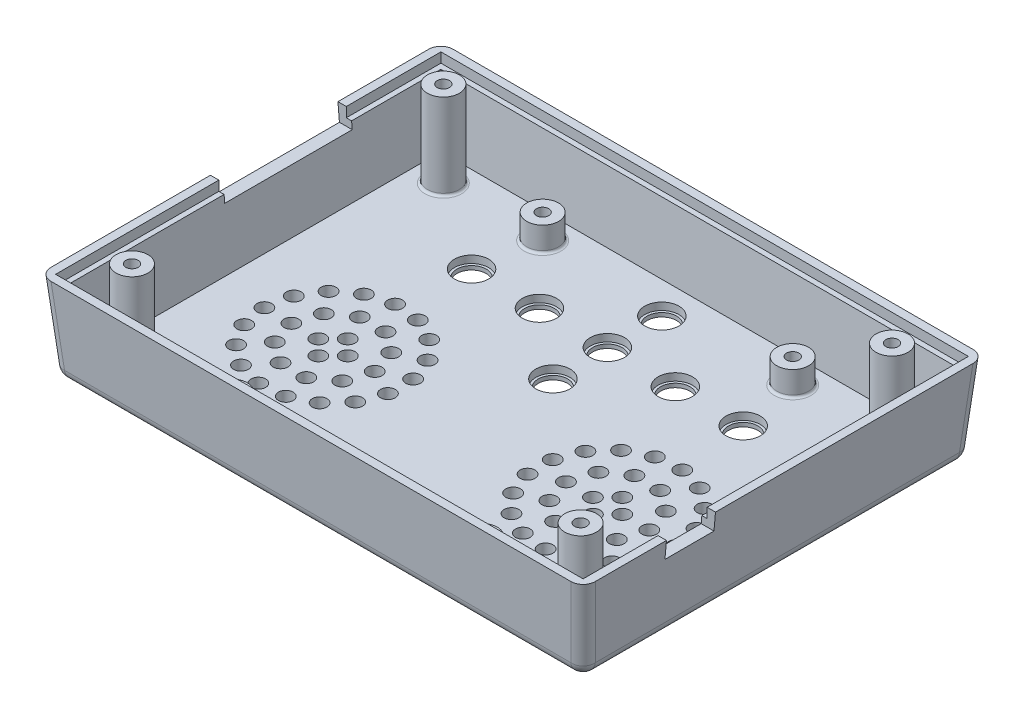
from build123d import *

# Parameters (mm, degrees)
SKETCH_1_W             = 111
SKETCH_1_H             = 82
EXTRUDE_466_DEPTH      = 18
EXTRUDE_466_DRAFT      = -5
SHELL_544_T            = -2.6
FILLET_584_R           = 2.5
SKETCH_7_W             = 102
SKETCH_7_H             = 73
CUT_EXTRUDE_1196_DEPTH = 0.3
CUT_EXTRUDE_1542_DEPTH = 2
SKETCH_4_R             = 3.25
SKETCH_4_R_2           = 1.25
EXTRUDE_3_DEPTH        = 17.5
FILLET_2_R             = 0.5
FILLET_2_OF_MIRROR_1_R = 0.5
SKETCH_8_R             = 3.25
SKETCH_8_R_2           = 1.25
EXTRUDE_4_DEPTH        = 5
FILLET_3_R             = 0.5
FILLET_3_OF_MIRROR_7_R = 0.5
SKETCH_9_W             = 26
SKETCH_9_H             = 3.5
CUT_EXTRUDE_2560_DEPTH = 5
SKETCH_10_W            = 10
SKETCH_10_H            = 3.5
CUT_EXTRUDE_2738_DEPTH = 5
SKETCH_12_R            = 3
CUT_EXTRUDE_3424_DEPTH = 4
SKETCH_14_R            = 3.5
CUT_EXTRUDE_4064_DEPTH = 1.5
SKETCH_13_R            = 1.5
CUT_EXTRUDE_4136_DEPTH = 3
SKETCH_15_R            = 1.5
CUT_EXTRUDE_12_DEPTH   = 3


# Read off the part's stored shape, not the designer's step: Зеркальное отражение2, Зеркальное отражение8
with BuildPart() as part:
    # Эскиз1 → Extrude 466 (with draft: the straight prism first)
    with BuildSketch(Plane(origin=(0, 0, 0), x_dir=(1, 0, 0), z_dir=(0, 1, 0))):
        Rectangle(SKETCH_1_W, SKETCH_1_H)
    extrude(amount=-EXTRUDE_466_DEPTH)
    # Extrude 466: the draft: its side faces are tilted about the plane it starts from
    extrude_466_sides = [part.faces().sort_by_distance(p)[0] for p in [
        (-55.5, -9, 0),
        (0, -9, 41),
        (55.5, -9, 0),
        (0, -9, -41),
    ]]
    draft(extrude_466_sides, Plane(origin=(0, 0, 0), x_dir=(1, 0, 0), z_dir=(0, 1, 0)), EXTRUDE_466_DRAFT)

    # Shell 544
    shell_544_openings = [part.faces().sort_by_distance(p)[0] for p in [
        (0, 0, 0),
    ]]
    offset(amount=SHELL_544_T, openings=shell_544_openings, kind=Kind.INTERSECTION)

    # Fillet 584
    fillet_584_edges = [part.edges().sort_by_distance(p)[0] for p in [
        (53.925204057, -18, 0),
        (0, -18, -39.425204057),
        (-53.925204057, -18, 0),
        (0, -18, 39.425204057),
        (-54.712602028, -9, -40.212602028),
        (54.712602028, -9, -40.212602028),
        (54.712602028, -9, 40.212602028),
        (-54.712602028, -9, 40.212602028),
    ]]
    fillet(fillet_584_edges, radius=FILLET_584_R)

    # Эскиз7 → Cut-Extrude 1196 (cut)
    with BuildSketch(Plane.XZ.offset(18)):
        Rectangle(SKETCH_7_W, SKETCH_7_H)
    extrude(amount=-CUT_EXTRUDE_1196_DEPTH, mode=Mode.SUBTRACT)

    # Эскиз3 → Cut-Extrude 1542 (cut)
    with BuildSketch(Plane(origin=(0, 0, 0), x_dir=(-1, 0, 0), z_dir=(0, 1, 0))):
        Polygon((-53.79, 39.29), (-53.79, -39.290136845), (53.79, -39.29), (53.79, 39.29), align=None)
    extrude(amount=-CUT_EXTRUDE_1542_DEPTH, mode=Mode.SUBTRACT)

    # Эскиз4 → Бобышка-Вытянуть3 (add)
    with BuildSketch(Plane(origin=(0, -15.4, 0), x_dir=(1, 0, 0), z_dir=(0, 1, 0))):
        with Locations(Location((-45.75, 31.75, 0), (0, 0, 270))):
            Circle(SKETCH_4_R)
        with Locations(Location((-45.75, 31.75, 0), (0, 0, 270))):
            Circle(SKETCH_4_R_2, mode=Mode.SUBTRACT)
    extrude_3 = extrude(amount=EXTRUDE_3_DEPTH)

    # Скругление2
    fillet_2_edges = [part.edges().sort_by_distance(p)[0] for p in [
        (-45.75, -15.4, -35),
    ]]
    fillet(fillet_2_edges, radius=FILLET_2_R)

    # Зеркальное отражение1: Бобышка-Вытянуть3 across plane
    add(extrude_3.mirror(Plane(origin=(0, 0, 0), x_dir=(0, 0, 1), z_dir=(1, 0, 0))))

    # Скругление2 of Зеркальное отражение1
    fillet_2_of_mirror_1_edges = [part.edges().sort_by_distance(p)[0] for p in [
        (45.75, -15.4, -35),
    ]]
    fillet(fillet_2_of_mirror_1_edges, radius=FILLET_2_OF_MIRROR_1_R)

    # Зеркальное отражение2 outline → Зеркальное отражение2 (revolve)
    with BuildSketch(Plane(origin=(45.75, 0, 31.75), x_dir=(1, 0, 0), z_dir=(0, 0, 1))):
        with BuildLine():
            Line((3.25, 2.1), (1.25, 2.1))
            Line((1.25, 2.1), (1.25, -15.4))
            Line((1.25, -15.4), (3.75, -15.4))
            ThreePointArc((3.75, -15.4), (3.396446609, -15.253553391), (3.25, -14.9))
            Line((3.25, -14.9), (3.25, 2.1))
        make_face()
    revolve(axis=Axis((45.75, 0, 31.75), (0, 1, 0)))

    # Mirror 2 2 outline → Mirror 2 2 (revolve)
    with BuildSketch(Plane(origin=(-45.75, 0, 31.75), x_dir=(1, 0, 0), z_dir=(0, 0, 1))):
        with BuildLine():
            Line((3.25, 2.1), (1.25, 2.1))
            Line((1.25, 2.1), (1.25, -15.4))
            Line((1.25, -15.4), (3.75, -15.4))
            ThreePointArc((3.75, -15.4), (3.396446609, -15.253553391), (3.25, -14.9))
            Line((3.25, -14.9), (3.25, 2.1))
        make_face()
    revolve(axis=Axis((-45.75, 0, 31.75), (0, 1, 0)))

    # Эскиз8 → Бобышка-Вытянуть4 (add)
    with BuildSketch(Plane(origin=(0, -15.4, 0), x_dir=(1, 0, 0), z_dir=(0, 1, 0))):
        with Locations(Location((-25.5, 31.75, 0), (0, 0, 270))):
            Circle(SKETCH_8_R)
        with Locations(Location((-25.5, 31.75, 0), (0, 0, 270))):
            Circle(SKETCH_8_R_2, mode=Mode.SUBTRACT)
    extrude_4 = extrude(amount=EXTRUDE_4_DEPTH)

    # Скругление3
    fillet_3_edges = [part.edges().sort_by_distance(p)[0] for p in [
        (-25.5, -15.4, -35),
    ]]
    fillet(fillet_3_edges, radius=FILLET_3_R)

    # Зеркальное отражение7: Бобышка-Вытянуть4 across plane
    add(extrude_4.mirror(Plane(origin=(0, 0, 0), x_dir=(0, 0, 1), z_dir=(1, 0, 0))))

    # Скругление3 of Зеркальное отражение7
    fillet_3_of_mirror_7_edges = [part.edges().sort_by_distance(p)[0] for p in [
        (25.5, -15.4, -35),
    ]]
    fillet(fillet_3_of_mirror_7_edges, radius=FILLET_3_OF_MIRROR_7_R)

    # Зеркальное отражение8 outline → Зеркальное отражение8 (revolve)
    with BuildSketch(Plane(origin=(25.5, 0, 31.75), x_dir=(1, 0, 0), z_dir=(0, 0, 1))):
        with BuildLine():
            Line((3.25, -10.4), (1.25, -10.4))
            Line((1.25, -10.4), (1.25, -15.4))
            Line((1.25, -15.4), (3.75, -15.4))
            ThreePointArc((3.75, -15.4), (3.396446609, -15.253553391), (3.25, -14.9))
            Line((3.25, -14.9), (3.25, -10.4))
        make_face()
    revolve(axis=Axis((25.5, 0, 31.75), (0, 1, 0)))

    # Mirror 8 2 outline → Mirror 8 2 (revolve)
    with BuildSketch(Plane(origin=(-25.5, 0, 31.75), x_dir=(1, 0, 0), z_dir=(0, 0, 1))):
        with BuildLine():
            Line((3.25, -10.4), (1.25, -10.4))
            Line((1.25, -10.4), (1.25, -15.4))
            Line((1.25, -15.4), (3.75, -15.4))
            ThreePointArc((3.75, -15.4), (3.396446609, -15.253553391), (3.25, -14.9))
            Line((3.25, -14.9), (3.25, -10.4))
        make_face()
    revolve(axis=Axis((-25.5, 0, 31.75), (0, 1, 0)))

    # Эскиз9 → Cut-Extrude 2560 (cut)
    with BuildSketch(Plane(origin=(-55.5, 0, 0), x_dir=(0, 0, -1), z_dir=(1, 0, 0))):
        with Locations((7, -1.75)):
            Rectangle(SKETCH_9_W, SKETCH_9_H)
    extrude(amount=CUT_EXTRUDE_2560_DEPTH, mode=Mode.SUBTRACT)

    # Эскиз10 → Cut-Extrude 2738 (cut)
    with BuildSketch(Plane(origin=(55.5, 0, 0), x_dir=(0, 0, -1), z_dir=(1, 0, 0))):
        with Locations((-19, -1.75)):
            Rectangle(SKETCH_10_W, SKETCH_10_H)
    extrude(amount=-CUT_EXTRUDE_2738_DEPTH, mode=Mode.SUBTRACT)

    # Эскиз12 → Cut-Extrude 3424 (cut)
    with BuildSketch(Plane(origin=(0, -17.7, -17.7), x_dir=(1, 0, 0), z_dir=(0, 1, 0))):
        with Locations(Location((0, 12.86, 0), (0, 0, 270))):
            Circle(SKETCH_12_R)
        with Locations(Location((-13.85, 1.75, 0), (0, 0, 270))):
            Circle(SKETCH_12_R)
        with Locations(Location((13.85, 1.75, 0), (0, 0, 270))):
            Circle(SKETCH_12_R)
        with Locations(Location((-27.7, 1.75, 0), (0, 0, 270))):
            Circle(SKETCH_12_R)
        with Locations(Location((27.7, 1.75, 0), (0, 0, 270))):
            Circle(SKETCH_12_R)
        with Locations(Location((0, -47.55, 0), (0, 0, 270))):
            Circle(SKETCH_12_R)
        with Locations(Location((0, 1.75, 0), (0, 0, 270))):
            Circle(SKETCH_12_R)
        with Locations(Location((0, -9.35, 0), (0, 0, 270))):
            Circle(SKETCH_12_R)
    extrude(amount=CUT_EXTRUDE_3424_DEPTH, mode=Mode.SUBTRACT)

    # Эскиз14 → Cut-Extrude 4064 (cut)
    with BuildSketch(Plane(origin=(0, -15.4, 0), x_dir=(1, 0, 0), z_dir=(0, 1, 0))):
        with Locations(Location((0, 30.56, 0), (0, 0, 270))):
            Circle(SKETCH_14_R)
        with Locations(Location((-13.85, 19.45, 0), (0, 0, 270))):
            Circle(SKETCH_14_R)
        with Locations(Location((13.85, 19.45, 0), (0, 0, 270))):
            Circle(SKETCH_14_R)
        with Locations(Location((-27.7, 19.45, 0), (0, 0, 270))):
            Circle(SKETCH_14_R)
        with Locations(Location((27.7, 19.45, 0), (0, 0, 270))):
            Circle(SKETCH_14_R)
        with Locations(Location((0, -29.85, 0), (0, 0, 270))):
            Circle(SKETCH_14_R)
        with Locations(Location((0, 19.45, 0), (0, 0, 270))):
            Circle(SKETCH_14_R)
        with Locations(Location((0, 8.35, 0), (0, 0, 270))):
            Circle(SKETCH_14_R)
    extrude(amount=-CUT_EXTRUDE_4064_DEPTH, mode=Mode.SUBTRACT)

    # Эскиз13 → Cut-Extrude 4136 (cut)
    with BuildSketch(Plane.XZ.offset(17.7)):
        with Locations(Location((42, 8.5, 0), (0, 0, 270))):
            Circle(SKETCH_13_R)
        with Locations(Location((36.5, 8.5, 0), (0, 0, 270))):
            Circle(SKETCH_13_R)
        with Locations(Location((31, 8.5, 0), (0, 0, 270))):
            Circle(SKETCH_13_R)
        with Locations(Location((34.876644452, 3.503825356, 0), (0, 0, 270))):
            Circle(SKETCH_13_R)
        with Locations(Location((30.626644452, 0.416019611, 0), (0, 0, 270))):
            Circle(SKETCH_13_R)
        with Locations(Location((25.373355548, 0.416019611, 0), (0, 0, 270))):
            Circle(SKETCH_13_R)
        with Locations(Location((21.123355548, 3.503825356, 0), (0, 0, 270))):
            Circle(SKETCH_13_R)
        with Locations(Location((19.5, 8.5, 0), (0, 0, 270))):
            Circle(SKETCH_13_R)
        with Locations(Location((21.123355548, 13.496174644, 0), (0, 0, 270))):
            Circle(SKETCH_13_R)
        with Locations(Location((25.373355548, 16.583980389, 0), (0, 0, 270))):
            Circle(SKETCH_13_R)
        with Locations(Location((30.626644452, 16.583980389, 0), (0, 0, 270))):
            Circle(SKETCH_13_R)
        with Locations(Location((34.876644452, 13.496174644, 0), (0, 0, 270))):
            Circle(SKETCH_13_R)
        with Locations(Location((28, 5.5, 0), (0, 0, 270))):
            Circle(SKETCH_13_R)
        with Locations(Location((25, 8.5, 0), (0, 0, 270))):
            Circle(SKETCH_13_R)
        with Locations(Location((28, 11.5, 0), (0, 0, 270))):
            Circle(SKETCH_13_R)
        with Locations(Location((41.054611212, 3.442616673, 0), (0, 0, 270))):
            Circle(SKETCH_13_R)
        with Locations(Location((38.346124841, -0.931739011, 0), (0, 0, 270))):
            Circle(SKETCH_13_R)
        with Locations(Location((34.240336981, -4.032286079, 0), (0, 0, 270))):
            Circle(SKETCH_13_R)
        with Locations(Location((29.291757032, -5.440278468, 0), (0, 0, 270))):
            Circle(SKETCH_13_R)
        with Locations(Location((24.168718139, -4.965559004, 0), (0, 0, 270))):
            Circle(SKETCH_13_R)
        with Locations(Location((19.563115091, -2.672241182, 0), (0, 0, 270))):
            Circle(SKETCH_13_R)
        with Locations(Location((16.0969601, 1.12994972, 0), (0, 0, 270))):
            Circle(SKETCH_13_R)
        with Locations(Location((14.238376604, 5.927506751, 0), (0, 0, 270))):
            Circle(SKETCH_13_R)
        with Locations(Location((14.238376604, 11.072493249, 0), (0, 0, 270))):
            Circle(SKETCH_13_R)
        with Locations(Location((16.0969601, 15.87005028, 0), (0, 0, 270))):
            Circle(SKETCH_13_R)
        with Locations(Location((19.563115091, 19.672241182, 0), (0, 0, 270))):
            Circle(SKETCH_13_R)
        with Locations(Location((24.168718139, 21.965559004, 0), (0, 0, 270))):
            Circle(SKETCH_13_R)
        with Locations(Location((29.291757032, 22.440278468, 0), (0, 0, 270))):
            Circle(SKETCH_13_R)
        with Locations(Location((34.240336981, 21.032286079, 0), (0, 0, 270))):
            Circle(SKETCH_13_R)
        with Locations(Location((38.346124841, 17.931739011, 0), (0, 0, 270))):
            Circle(SKETCH_13_R)
        with Locations(Location((41.054611212, 13.557383327, 0), (0, 0, 270))):
            Circle(SKETCH_13_R)
    cut_extrude_4136 = extrude(amount=-CUT_EXTRUDE_4136_DEPTH, mode=Mode.SUBTRACT)

    # Зеркальное отражение9: Cut-Extrude 4136 across plane
    add(cut_extrude_4136.mirror(Plane(origin=(0, 0, 0), x_dir=(0, 0, 1), z_dir=(1, 0, 0))), mode=Mode.SUBTRACT)

    # Эскиз15 → Вырез-Вытянуть12 (cut)
    with BuildSketch(Plane(origin=(0, -17.7, 0), x_dir=(1, 0, 0), z_dir=(0, 1, 0))):
        with Locations(Location((36, -31.5, 0), (0, 0, 270))):
            Circle(SKETCH_15_R)
    extrude(amount=CUT_EXTRUDE_12_DEPTH, mode=Mode.SUBTRACT)


solid = part.part
